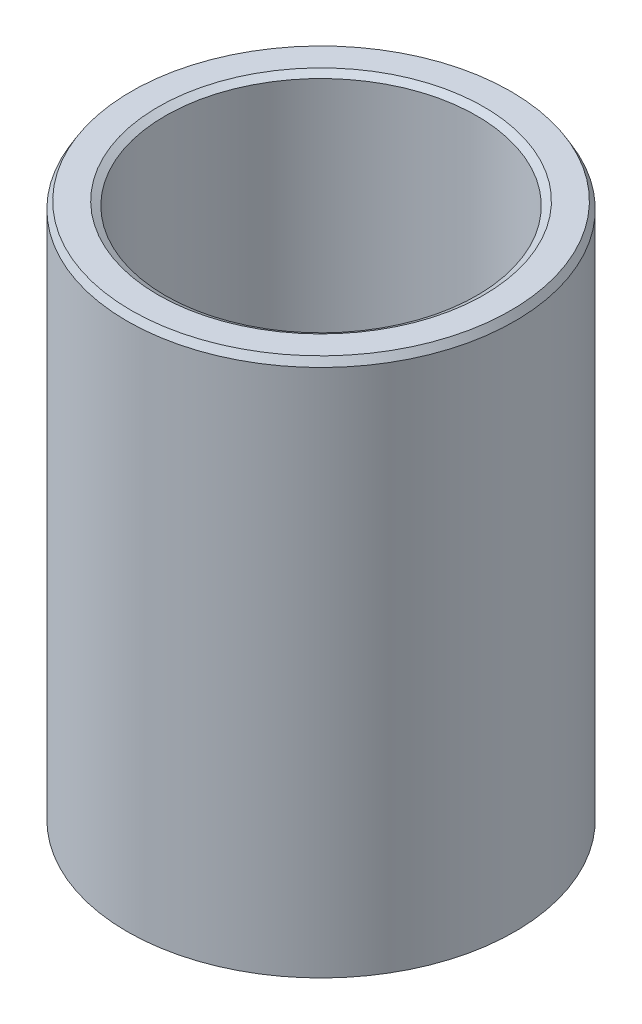
from build123d import *
from OCP.BRepFilletAPI import BRepFilletAPI_MakeChamfer

# Parameters (mm, degrees)
SKETCH1_R           = 27.5
BOSS_EXTRUDE1_DEPTH = 76.585436555
SKETCH2_R           = 22.087763927
CUT_EXTRUDE1_DEPTH  = 86.894290219
CHAMFER1_SIZE       = 1.016270703
CHAMFER1_SIZE2      = 0.586744164


with BuildPart() as part:
    # Sketch1 → Boss-Extrude1 (new body)
    with BuildSketch(Plane(origin=(0, 0, 0), x_dir=(1, 0, 0), z_dir=(0, 1, 0))):
        Circle(SKETCH1_R)
    extrude(amount=BOSS_EXTRUDE1_DEPTH)

    # Sketch2 → Cut-Extrude1 (cut, through all)
    with BuildSketch(Plane(origin=(0, 0, 0), x_dir=(1, 0, 0), z_dir=(0, 1, 0))):
        Circle(SKETCH2_R)
    extrude(amount=CUT_EXTRUDE1_DEPTH, mode=Mode.SUBTRACT)

    # Chamfer1: one chamfer whose edges measure the first distance from different faces: ONE call of the kernel's chamfer builder (chamfer() names one face for all edges)
    chamfer1_edges_1 = [part.edges().sort_by_distance(p)[0] for p in [
        (-22.087763927, 76.585436555, 0),
    ]]
    chamfer1_side_1 = [part.faces().sort_by_distance(p)[0] for p in [
        (-26.722182541, 76.585436555, 0),
    ]]
    chamfer1_edges_2 = [part.edges().sort_by_distance(p)[0] for p in [
        (-22.087763927, 0, 0),
    ]]
    chamfer1_side_2 = [part.faces().sort_by_distance(p)[0] for p in [
        (-22.087763927, 38.292718277, 0),
    ]]
    chamfer1_edges_3 = [part.edges().sort_by_distance(p)[0] for p in [
        (-27.5, 0, 0),
    ]]
    chamfer1_side_3 = [part.faces().sort_by_distance(p)[0] for p in [
        (-26.722182541, 0, 0),
    ]]
    chamfer1_edges_4 = [part.edges().sort_by_distance(p)[0] for p in [
        (-27.5, 76.585436555, 0),
    ]]
    chamfer1_side_4 = [part.faces().sort_by_distance(p)[0] for p in [
        (-27.5, 38.292718277, 0),
    ]]
    chamfer1 = BRepFilletAPI_MakeChamfer(part.part.solid().wrapped)
    for e in chamfer1_edges_1:
        chamfer1.Add(CHAMFER1_SIZE, CHAMFER1_SIZE2, e.wrapped, chamfer1_side_1[0].wrapped)  # the first distance lies on this face
    for e in chamfer1_edges_2:
        chamfer1.Add(CHAMFER1_SIZE, CHAMFER1_SIZE2, e.wrapped, chamfer1_side_2[0].wrapped)  # the first distance lies on this face
    for e in chamfer1_edges_3:
        chamfer1.Add(CHAMFER1_SIZE, CHAMFER1_SIZE2, e.wrapped, chamfer1_side_3[0].wrapped)  # the first distance lies on this face
    for e in chamfer1_edges_4:
        chamfer1.Add(CHAMFER1_SIZE, CHAMFER1_SIZE2, e.wrapped, chamfer1_side_4[0].wrapped)  # the first distance lies on this face
    add(Compound.cast(chamfer1.Shape()), mode=Mode.REPLACE)


solid = part.part
